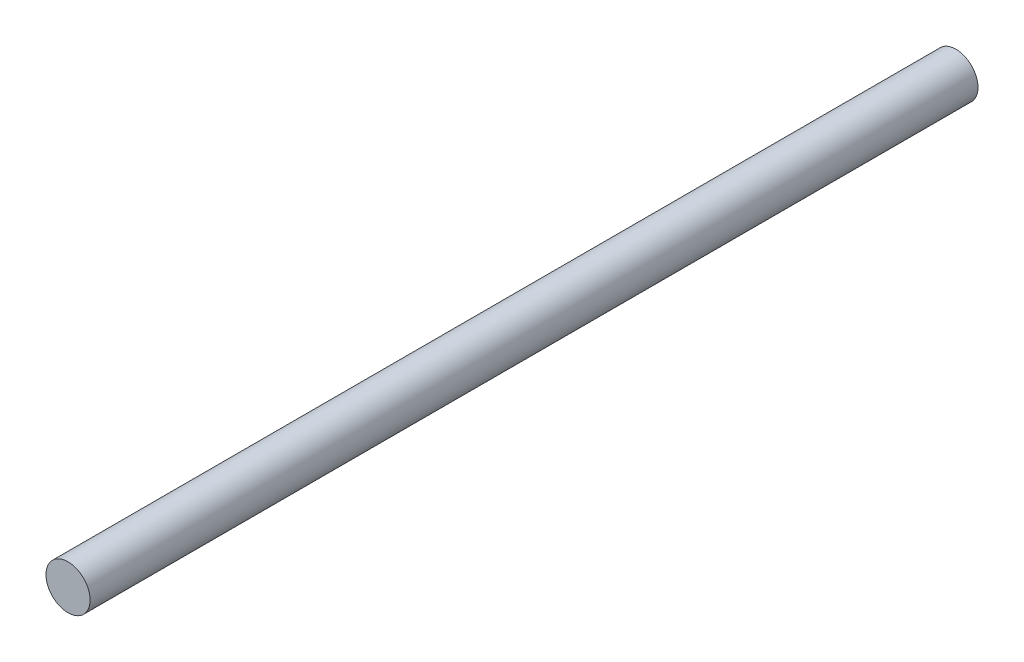
from build123d import *

# Parameters (mm, degrees)
SKETCH1_R           = 1.94
BOSS_EXTRUDE1_DEPTH = 78


with BuildPart() as part:
    # Sketch1 → Boss-Extrude1 (new body)
    with BuildSketch(Plane.XY):
        Circle(SKETCH1_R)
    extrude(amount=BOSS_EXTRUDE1_DEPTH)


solid = part.part
